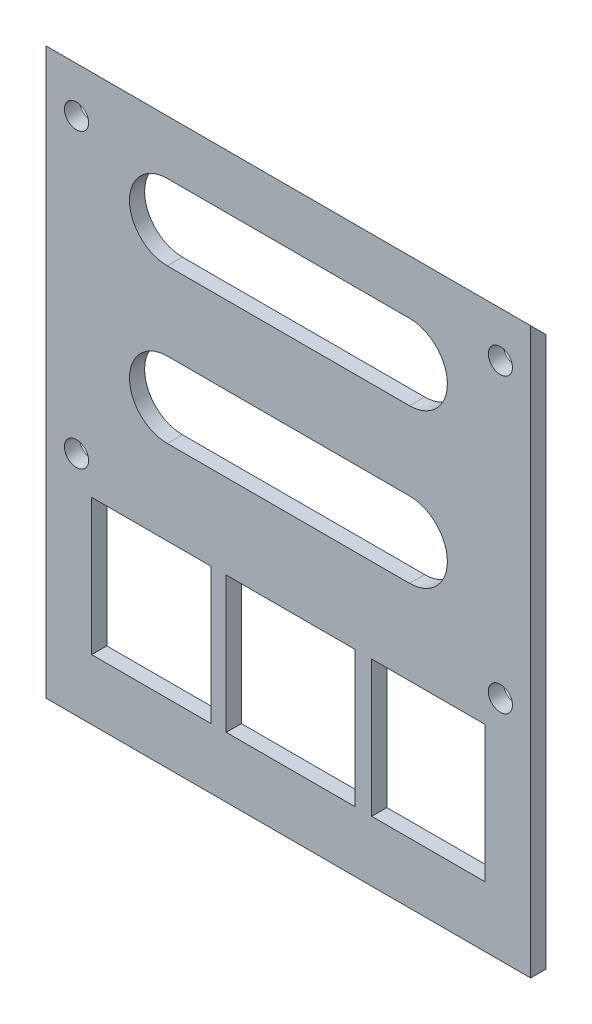
from build123d import *

# Parameters (mm, degrees)
SZKIC1_W                    = 64
SZKIC1_H                    = 72.64
SZKIC1_W_2                  = 52
SZKIC1_H_2                  = 18
SZKIC1_H_3                  = 2
DODANIE_WYCI_GNI_CIE1_DEPTH = 2
SFAZOWANIE1_SIZE            = 2
SZKIC2_R                    = 1.6
WYTNIJ_WYCI_GNI_CIE1_DEPTH  = 2
SZKIC3_W                    = 2.216566571
SZKIC3_H                    = 18
SZKIC3_W_2                  = 2
DODANIE_WYCI_GNI_CIE2_DEPTH = 2
WYTNIJ_WYCI_GNI_CIE2_DEPTH  = 2


with BuildPart() as part:
    # Szkic1 → Dodanie-wyciągnięcie1 (new body)
    # profile 1 of 2: a face of its own
    with BuildSketch(Plane.XY):
        with Locations((32, 36.32)):
            Rectangle(SZKIC1_W, SZKIC1_H)
        with Locations((32, 17)):
            Rectangle(SZKIC1_W_2, SZKIC1_H_2, mode=Mode.SUBTRACT)
    # profile 2 of 2: a face of its own
    with BuildSketch(Plane.XY):
        with Locations((32, 73.64)):
            Rectangle(SZKIC1_W, SZKIC1_H_3)
    extrude(amount=DODANIE_WYCI_GNI_CIE1_DEPTH)

    # Sfazowanie1
    sfazowanie1_edges = [part.edges().sort_by_distance(p)[0] for p in [
        (32, 74.64, 0),
    ]]
    chamfer(sfazowanie1_edges, length=SFAZOWANIE1_SIZE - 0.0001)  # a hair under: the kernel refuses the full size

    # Szkic2 → Wytnij-wyciągnięcie1 (cut)
    with BuildSketch(Plane.XY.offset(2)):
        with Locations((4, 30)):
            Circle(SZKIC2_R)
        with Locations((60, 30)):
            Circle(SZKIC2_R)
        with Locations((4, 68.64)):
            Circle(SZKIC2_R)
        with Locations((60, 68.64)):
            Circle(SZKIC2_R)
    extrude(amount=-WYTNIJ_WYCI_GNI_CIE1_DEPTH, mode=Mode.SUBTRACT)

    # Szkic3 → Dodanie-wyciągnięcie2 (add)
    with BuildSketch(Plane.XY.offset(2)):
        with Locations((41.891716715, 17)):
            Rectangle(SZKIC3_W, SZKIC3_H)
        with Locations((22.783433429, 17)):
            Rectangle(SZKIC3_W_2, SZKIC3_H)
    extrude(amount=-DODANIE_WYCI_GNI_CIE2_DEPTH)

    # Szkic4 → Wytnij-wyciągnięcie2 (cut)
    with BuildSketch(Plane(origin=(0, 0, 0), x_dir=(-1, 0, 0), z_dir=(0, 0, -1))):
        with BuildLine():
            Line((-48, 47.16), (-16, 47.16))
            ThreePointArc((-16, 47.16), (-11, 42.16), (-16, 37.16))
            Line((-16, 37.16), (-48, 37.16))
            ThreePointArc((-48, 37.16), (-53, 42.16), (-48, 47.16))
        make_face()
        with BuildLine():
            Line((-48, 67.48), (-16, 67.48))
            ThreePointArc((-16, 67.48), (-11, 62.48), (-16, 57.48))
            Line((-16, 57.48), (-48, 57.48))
            ThreePointArc((-48, 57.48), (-53, 62.48), (-48, 67.48))
        make_face()
    extrude(amount=-WYTNIJ_WYCI_GNI_CIE2_DEPTH, mode=Mode.SUBTRACT)


solid = part.part
